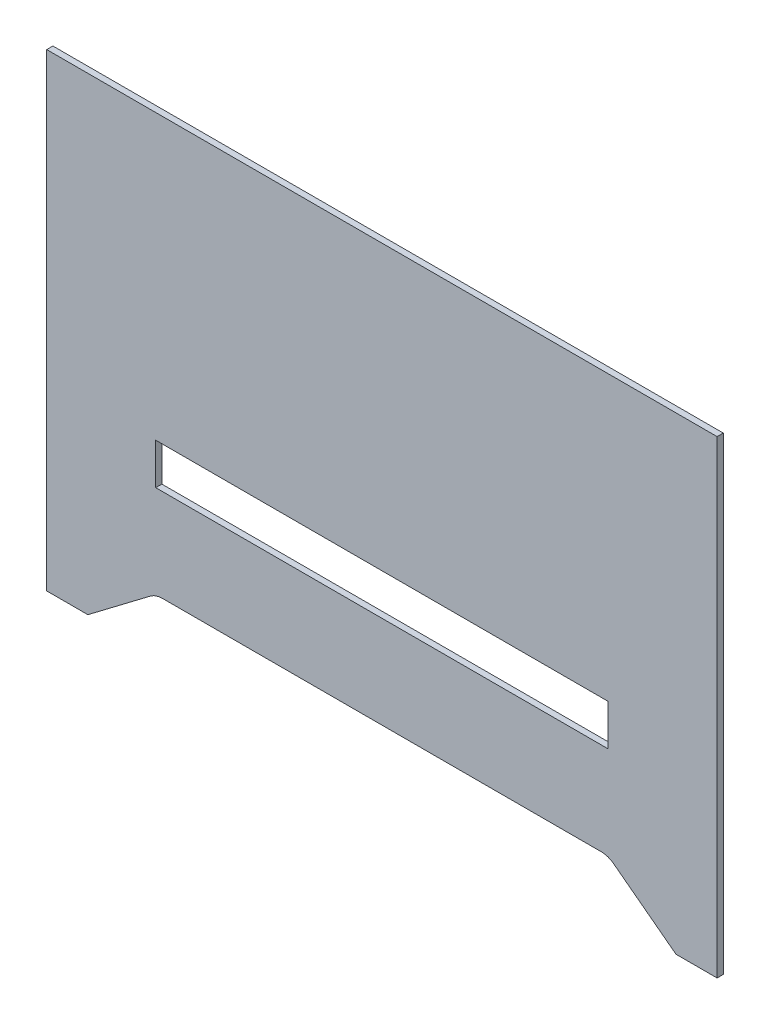
from build123d import *

# Parameters (mm, degrees)
SKETCH1_W           = 220
SKETCH1_H           = 20
BOSS_EXTRUDE1_DEPTH = 3


with BuildPart() as part:
    # Sketch1 → Boss-Extrude1 (new body)
    with BuildSketch(Plane.XY):
        with BuildLine():
            Line((-163, -114), (-163, 114))
            Line((-163, 114), (163, 114))
            Line((163, 114), (163, -114))
            Line((163, -114), (143, -114))
            Line((143, -114), (112.678383644, -91.029078518))
            ThreePointArc((112.678383644, -91.029078518), (109.824990055, -89.520832979), (106.639806764, -89))
            Line((106.639806764, -89), (-106.639806764, -89))
            ThreePointArc((-106.639806764, -89), (-109.824990055, -89.520832979), (-112.678383644, -91.029078518))
            Line((-112.678383644, -91.029078518), (-143, -114))
            Line((-143, -114), (-163, -114))
        make_face()
        with Locations((0, -34)):
            Rectangle(SKETCH1_W, SKETCH1_H, mode=Mode.SUBTRACT)
    extrude(amount=BOSS_EXTRUDE1_DEPTH)


solid = part.part
